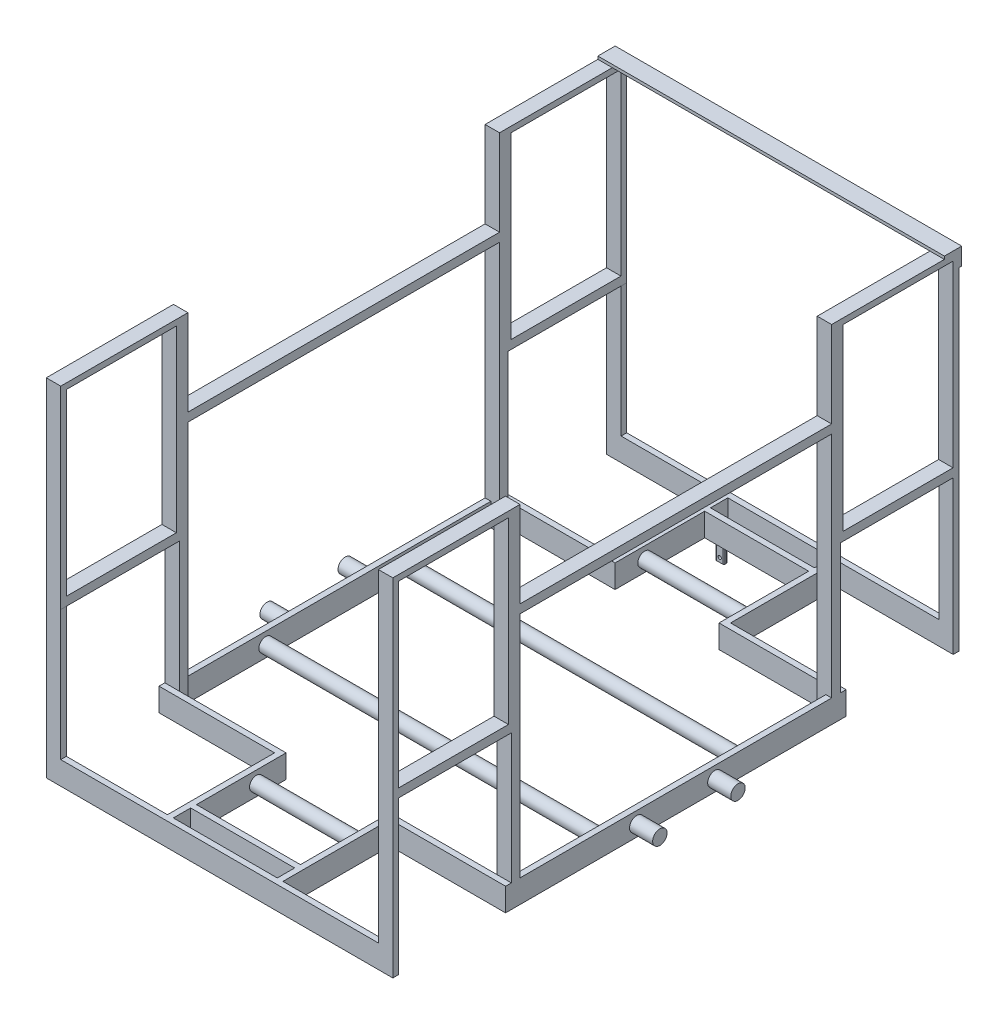
from build123d import *
from build123d.topology import SkipClean

# Parameters (mm, degrees)
SKETCH2_W            = 180
SKETCH2_H            = 30
BOSS_EXTRUDE1_DEPTH  = 40
SKETCH3_R            = 12
BOSS_EXTRUDE2_DEPTH  = 582
SKETCH4_R            = 12
BOSS_EXTRUDE3_DEPTH  = 586
SKETCH5_R            = 12
BOSS_EXTRUDE4_DEPTH  = 185
SKETCH6_W            = 15
SKETCH6_H            = 6
BOSS_EXTRUDE5_DEPTH  = 26.25
FILLET1_R            = 7.5
SKETCH7_R            = 2.912785327
CUT_EXTRUDE1_DEPTH   = 22.5
FILLET3_R            = 2
SKETCH8_R            = 12.5
BOSS_EXTRUDE6_DEPTH  = 40
SKETCH11_W           = 25
SKETCH11_H           = 9.755258218
BOSS_EXTRUDE8_DEPTH  = 265
SKETCH12_W           = 24.999989214
SKETCH12_H           = 15
BOSS_EXTRUDE9_DEPTH  = 205.224939
SKETCH14_W           = 24.999989214
SKETCH14_H           = 15
BOSS_EXTRUDE11_DEPTH = 280
MIRROR6_OUTLINE_W    = 25
MIRROR6_OUTLINE_H    = 9.755258218
MIRROR6_DEPTH        = 280
MIRROR6_START        = 265
MIRROR6_2_DEPTH      = 15
MIRROR6_START_2      = -15.837214573
MIRROR6_3_DEPTH      = 15.837214573
MIRROR6_START_3      = -26.25
MIRROR6_4_DEPTH      = 4.587214573
MIRROR6_START_4      = -21.662785427
MIRROR6_5_DEPTH      = 5.825570854
MIRROR6_START_5      = 299
MIRROR6_6_OUTLINE_R  = 12.5
MIRROR6_6_DEPTH      = 41
MIRROR6_START_6      = 942.321343688
MIRROR6_7_OUTLINE_R  = 2.912785327
MIRROR6_7_DEPTH      = 6
CUT_EXTRUDE4_START   = -490
SKETCH15_W           = 830.529975389
SKETCH15_H           = 463.712569592
CUT_EXTRUDE4_DEPTH   = 594.558950865
SKETCH16_W           = 24.999989214
SKETCH16_H           = 9.755258218
BOSS_EXTRUDE12_DEPTH = 320
SKETCH17_W           = 24.999989214
SKETCH17_H           = 10
BOSS_EXTRUDE13_DEPTH = 960.489483565
SKETCH18_W           = 24.999989214
SKETCH18_H           = 10
BOSS_EXTRUDE14_DEPTH = 320
SKETCH19_W           = 24.999989214
SKETCH19_H           = 20
BOSS_EXTRUDE15_DEPTH = 310
SKETCH21_W           = 24.999989214
SKETCH21_H           = 20
BOSS_EXTRUDE16_DEPTH = 310
BOSS_EXTRUDE17_DEPTH = 600
SKETCH25_W           = 24.999989214
SKETCH25_H           = 10
CUT_EXTRUDE6_DEPTH   = 539.550121
SKETCH26_W           = 24.999989214
SKETCH26_H           = 15.759189816
CUT_EXTRUDE7_DEPTH   = 539.550121
SKETCH27_W           = 24.999991857
SKETCH27_H           = 15
BOSS_EXTRUDE18_DEPTH = 539.55012142


with BuildPart() as part:
    # Sketch2 → Boss-Extrude1 (new body)
    with BuildSketch(Plane(origin=(0, 0, 0), x_dir=(1, 0, 0), z_dir=(0, 1, 0))):
        Polygon((0, 0), (-300, -294.775071815), (-300, -794.77506071), (-100, -794.77506071), (-100, -950), (-100, -980.244741782), (-300.00000013, -980.244741782), (-300.00000013, -990), (-100, -990), (100, -990), (299.99999987, -990), (299.99999987, -980.244741782), (100, -980.244741782), (100, -950), (100, -794.77506071), (300, -794.77506071), (300, -294.775071815), align=None)
        with Locations((0, -965)):
            Rectangle(SKETCH2_W, SKETCH2_H, mode=Mode.SUBTRACT)
        Polygon((0, -14.019523806), (-73.286387031, -86.029523806), (73.286387031, -86.029523806), align=None, mode=Mode.SUBTRACT)
        Polygon((-290, -298.968759893), (-290, -784.77506071), (-90, -784.77506071), (-90, -940), (90, -940), (90, -784.77506071), (290, -784.77506071), (290, -298.968759893), (83.463638389, -96.029523806), (-83.463638389, -96.029523806), align=None, mode=Mode.SUBTRACT)
    extrude(amount=BOSS_EXTRUDE1_DEPTH)

    # Sketch3 → Boss-Extrude2 (add)
    with BuildSketch(Plane(origin=(-290, 0, 0), x_dir=(0, 0, -1), z_dir=(1, 0, 0))):
        with Locations(Location((-321.785332303, 20, 0), (0, 0, 180))):
            Circle(SKETCH3_R)
    extrude(amount=BOSS_EXTRUDE2_DEPTH)

    # Sketch4 → Boss-Extrude3 (add)
    with BuildSketch(Plane(origin=(-290, 0, 0), x_dir=(0, 0, -1), z_dir=(1, 0, 0))):
        with Locations(Location((-620, 20, 0), (0, 0, 180))):
            Circle(SKETCH4_R)
    extrude(amount=BOSS_EXTRUDE3_DEPTH)

    # Sketch5 → Boss-Extrude4 (add)
    with BuildSketch(Plane(origin=(-90, 0, 0), x_dir=(0, 0, -1), z_dir=(1, 0, 0))):
        with Locations(Location((-836.106738249, 20, 0), (0, 0, 180))):
            Circle(SKETCH5_R)
    extrude(amount=BOSS_EXTRUDE4_DEPTH)

    # Sketch6 → Boss-Extrude5 (add)
    with BuildSketch(Plane.XZ):
        with Locations((-66.39, 945.321343688)):
            Rectangle(SKETCH6_W, SKETCH6_H)
    extrude(amount=BOSS_EXTRUDE5_DEPTH)

    # Fillet1
    fillet1_edges = [part.edges().sort_by_distance(p)[0] for p in [
        (-73.89, -26.25, 945.321343688),
        (-58.89, -26.25, 945.321343688),
    ]]
    fillet(fillet1_edges, radius=FILLET1_R - 0.0001)  # a hair under: the kernel refuses the full size

    # Sketch7 → Cut-Extrude1 (cut)
    with BuildSketch(Plane.XY.offset(948.321343688)):
        with Locations((-66.390010786, -18.75)):
            Circle(SKETCH7_R)
    extrude(amount=-CUT_EXTRUDE1_DEPTH, mode=Mode.SUBTRACT)

    # Fillet3
    fillet3_edges = [part.edges().sort_by_distance(p)[0] for p in [
        (-58.89, -9.37505, 942.321343688),
        (-73.89, -9.37505, 942.321343688),
        (-61.086669852, -24.053330148, 942.321343688),
        (-71.693330148, -24.053330148, 942.321343688),
        (-73.89, -9.37505, 948.321343688),
        (-58.89, -9.37505, 948.321343688),
        (-61.086669852, -24.053330148, 948.321343688),
        (-71.693330148, -24.053330148, 948.321343688),
    ]]
    fillet(fillet3_edges, radius=FILLET3_R)

    # Sketch8 → Boss-Extrude6 (add)
    with BuildSketch(Plane.ZY.offset(300)):
        with Locations(Location((567.635071815, 20, 0), (0, 0, 180))):
            Circle(SKETCH8_R)
    extrude(amount=BOSS_EXTRUDE6_DEPTH)

    # Sketch11 → Boss-Extrude8 (add)
    with BuildSketch(Plane.XZ):
        with Locations((-287.50000013, 985.122370891)):
            Rectangle(SKETCH11_W, SKETCH11_H)
    extrude(amount=-BOSS_EXTRUDE8_DEPTH)

    # Sketch12 → Boss-Extrude9 (add)
    with BuildSketch(Plane.XY.offset(990)):
        with Locations((-287.500005523, 272.5)):
            Rectangle(SKETCH12_W, SKETCH12_H)
    extrude(amount=-BOSS_EXTRUDE9_DEPTH)

    # Sketch14 → Boss-Extrude11 (add)
    with BuildSketch(Plane(origin=(0, 280, 0), x_dir=(1, 0, 0), z_dir=(0, 1, 0))):
        with Locations((-287.500005523, -777.27506071)):
            Rectangle(SKETCH14_W, SKETCH14_H)
    extrude(amount=-BOSS_EXTRUDE11_DEPTH)

    # Mirror6: read off the stored shape, not the designer's step
    # Mirror6 outline → Mirror6 (add)
    with BuildSketch(Plane(origin=(0, 0, 0), x_dir=(1, 0, 0), z_dir=(0, 1, 0))):
        with Locations((287.50000013, -985.122370891)):
            Rectangle(MIRROR6_OUTLINE_W, MIRROR6_OUTLINE_H)
        Polygon((275.000010916, -769.77506071), (275.000010916, -784.77506071), (300.00000013, -784.77506071), (300, -769.77506071), align=None)
    extrude(amount=MIRROR6_DEPTH)

    # Mirror6 2 outline → Mirror6 2 (add)
    with BuildSketch(Plane(origin=(0, 0, 0), x_dir=(1, 0, 0), z_dir=(0, 1, 0)).offset(MIRROR6_START)):
        Polygon((275.000010916, -784.77506071), (275.000010916, -980.244741782), (300.00000013, -980.244741782), (300, -784.77506071), align=None)
    extrude(amount=MIRROR6_2_DEPTH)

    # Mirror6 3 outline → Mirror6 3 (add)
    with BuildSketch(Plane(origin=(0, 0, 0), x_dir=(1, 0, 0), z_dir=(0, 1, 0)).offset(MIRROR6_START_2)):
        with BuildLine():
            ThreePointArc((73.89, -944.321343688), (73.304213562, -942.907130125), (71.89, -942.321343688))
            Line((71.89, -942.321343688), (60.89, -942.321343688))
            ThreePointArc((60.89, -942.321343688), (59.475786438, -942.907130125), (58.89, -944.321343688))
            Line((58.89, -944.321343688), (58.89, -946.321343688))
            ThreePointArc((58.89, -946.321343688), (59.475786438, -947.73555725), (60.89, -948.321343688))
            Line((60.89, -948.321343688), (71.89, -948.321343688))
            ThreePointArc((71.89, -948.321343688), (73.304213562, -947.73555725), (73.89, -946.321343688))
            Line((73.89, -946.321343688), (73.89, -944.321343688))
        make_face()
    extrude(amount=MIRROR6_3_DEPTH)



with BuildPart() as body_2:
    # Mirror6 4 outline → Mirror6 4 (new body)
    with BuildSketch(Plane(origin=(0, 0, 0), x_dir=(1, 0, 0), z_dir=(0, 1, 0)).offset(MIRROR6_START_3)):
        with BuildLine():
            ThreePointArc((73.89, -944.321343688), (73.304213562, -942.907130125), (71.89, -942.321343688))
            Line((71.89, -942.321343688), (60.89, -942.321343688))
            ThreePointArc((60.89, -942.321343688), (59.475786438, -942.907130125), (58.89, -944.321343688))
            Line((58.89, -944.321343688), (58.89, -946.321343688))
            ThreePointArc((58.89, -946.321343688), (59.475786438, -947.73555725), (60.89, -948.321343688))
            Line((60.89, -948.321343688), (71.89, -948.321343688))
            ThreePointArc((71.89, -948.321343688), (73.304213562, -947.73555725), (73.89, -946.321343688))
            Line((73.89, -946.321343688), (73.89, -944.321343688))
        make_face()
    extrude(amount=MIRROR6_4_DEPTH)


with BuildPart() as part_1:
    add(part.part)

    add(body_2.part)  # Mirror6 5 merges body 2
    # Mirror6 5 outline → Mirror6 5 (add)
    with BuildSketch(Plane(origin=(0, 0, 0), x_dir=(1, 0, 0), z_dir=(0, 1, 0)).offset(MIRROR6_START_4)):
        with BuildLine():
            ThreePointArc((73.89, -944.321343688), (73.304213562, -942.907130125), (71.89, -942.321343688))
            Line((71.89, -942.321343688), (60.89, -942.321343688))
            ThreePointArc((60.89, -942.321343688), (59.475786438, -942.907130125), (58.89, -944.321343688))
            Line((58.89, -944.321343688), (58.89, -946.321343688))
            ThreePointArc((58.89, -946.321343688), (59.475786438, -947.73555725), (60.89, -948.321343688))
            Line((60.89, -948.321343688), (71.89, -948.321343688))
            ThreePointArc((71.89, -948.321343688), (73.304213562, -947.73555725), (73.89, -946.321343688))
            Line((73.89, -946.321343688), (73.89, -944.321343688))
        make_face()
    extrude(amount=MIRROR6_5_DEPTH)

    # Mirror6 6 outline → Mirror6 6 (add)
    with BuildSketch(Plane.YZ.offset(MIRROR6_START_5)):
        with Locations((20, 567.635071815)):
            Circle(MIRROR6_6_OUTLINE_R)
    extrude(amount=MIRROR6_6_DEPTH)

    # Mirror6 7 outline → Mirror6 7 (cut)
    with BuildSketch(Plane.XY.offset(MIRROR6_START_6)):
        with Locations((66.390010786, -18.75)):
            Circle(MIRROR6_7_OUTLINE_R)
    extrude(amount=MIRROR6_7_DEPTH, mode=Mode.SUBTRACT)

    # Sketch15 → Cut-Extrude4 (cut, through all)
    with BuildSketch(Plane.XY.offset(990).offset(CUT_EXTRUDE4_START)):
        with Locations((-19.445991711, 124.596143132)):
            Rectangle(SKETCH15_W, SKETCH15_H)
    extrude(amount=-CUT_EXTRUDE4_DEPTH, mode=Mode.SUBTRACT)

    # Mirror10: part across plane


with BuildPart() as part_2:
    add(part_1.part)
    add(part_1.part.mirror(Plane(origin=(0, 0, 500), x_dir=(1, 0, 0), z_dir=(0, 0, -1))))

    # Sketch16 → Boss-Extrude12 (add)
    with BuildSketch(Plane(origin=(0, 280, 0), x_dir=(1, 0, 0), z_dir=(0, 1, 0))):
        with Locations((287.500005523, -985.122370891)):
            Rectangle(SKETCH16_W, SKETCH16_H)
    extrude(amount=BOSS_EXTRUDE12_DEPTH)

    # Sketch17 → Boss-Extrude13 (add)
    with BuildSketch(Plane(origin=(0, 0, 980.244741782), x_dir=(-1, 0, 0), z_dir=(0, 0, -1))):
        with Locations((-287.500005523, 595)):
            Rectangle(SKETCH17_W, SKETCH17_H)
    extrude(amount=BOSS_EXTRUDE13_DEPTH)

    # Sketch18 → Boss-Extrude14 (add)
    with BuildSketch(Plane(origin=(0, 280, 0), x_dir=(1, 0, 0), z_dir=(0, 1, 0))):
        with Locations((287.500005523, -15)):
            Rectangle(SKETCH18_W, SKETCH18_H)
    extrude(amount=BOSS_EXTRUDE14_DEPTH)

    # Sketch19 → Boss-Extrude15 (add)
    with BuildSketch(Plane(origin=(0, 280, 0), x_dir=(1, 0, 0), z_dir=(0, 1, 0))):
        with Locations((287.500005523, -779.77506071)):
            Rectangle(SKETCH19_W, SKETCH19_H)
    extrude(amount=BOSS_EXTRUDE15_DEPTH)

    # Sketch21 → Boss-Extrude16 (add)
    with BuildSketch(Plane(origin=(0, 280, 0), x_dir=(1, 0, 0), z_dir=(0, 1, 0))):
        with Locations((287.500005523, -220.22493929)):
            Rectangle(SKETCH21_W, SKETCH21_H)
    extrude(amount=BOSS_EXTRUDE16_DEPTH)

    # Mirror11: read off the stored shape, not the designer's step
    # Mirror11
    split(bisect_by=Plane(origin=(0, 0, 0), x_dir=(0, 0, 1), z_dir=(1, 0, 0)), keep=Keep.TOP)

    # Mirror11 2: part across plane


with BuildPart() as part_3:
    add(part_2.part)
    add(part_2.part.mirror(Plane(origin=(0, 0, 0), x_dir=(0, 0, 1), z_dir=(1, 0, 0))))

    # Sketch24 → Boss-Extrude17 (add)
    with BuildSketch(Plane.ZY.offset(300.00000013)):
        Polygon((10, 600), (35, 600), (35, 605), (5, 605), (5, 575), (10, 575), align=None)
    extrude(amount=-BOSS_EXTRUDE17_DEPTH)

    # Sketch25 → Cut-Extrude6 (cut)
    with BuildSketch(Plane(origin=(0, 0, 769.77506071), x_dir=(-1, 0, 0), z_dir=(0, 0, -1))):
        with Locations((-287.500005523, 595)):
            Rectangle(SKETCH25_W, SKETCH25_H)
    extrude(amount=CUT_EXTRUDE6_DEPTH, mode=Mode.SUBTRACT)

    # Sketch26 → Cut-Extrude7 (cut)
    with SkipClean():  # the faces are left unmerged after this step: merging them gives an invalid solid
        with BuildSketch(Plane(origin=(0, 0, 769.77506071), x_dir=(-1, 0, 0), z_dir=(0, 0, -1))):
            with Locations((287.500005523, 592.120405092)):
                Rectangle(SKETCH26_W, SKETCH26_H)
        extrude(amount=CUT_EXTRUDE7_DEPTH, mode=Mode.SUBTRACT)

    # Sketch27 → Boss-Extrude18 (add)
    with SkipClean():  # the faces are left unmerged after this step: merging them gives an invalid solid
        with BuildSketch(Plane.XY.offset(230.22493929)):
            with Locations((287.500004202, 443.379989562)):
                Rectangle(SKETCH27_W, SKETCH27_H)
            Polygon((-300.00000013, 435.879989562), (-275.000008273, 435.879989562), (-275.000008515, 450.879989562), (-300.00000013, 450.879989562), align=None)
        extrude(amount=BOSS_EXTRUDE18_DEPTH)


solid = part_3.part
